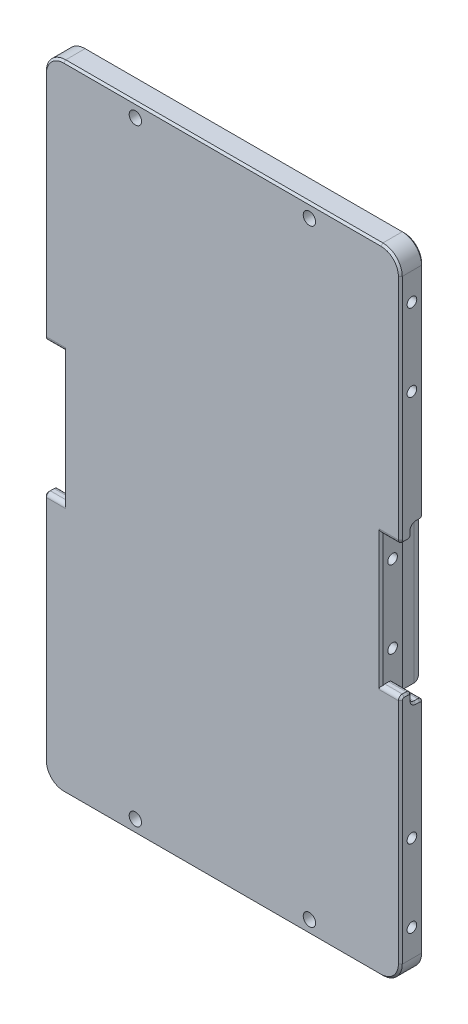
from build123d import *

# Parameters (mm, degrees)
SKETCH_1_W                  = 92
SKETCH_1_H                  = 164
EXTRUDE_1_DEPTH             = 3
SKETCH_97_W                 = 3
SKETCH_97_H                 = 34
CUT_EXTRUDE_1_DEPTH         = 5
HOLE_WIZARD_M3_1_AT_2_COUNT = 2
HOLE_WIZARD_M3_1_AT_2_PITCH = 20
HOLE_WIZARD_M3_2_AT_2_COUNT = 2
HOLE_WIZARD_M3_2_AT_2_PITCH = 140
HOLE_WIZARD_M3_2_AT_3_COUNT = 2
HOLE_WIZARD_M3_2_AT_3_PITCH = 20
HOLE_WIZARD_M3_2_AT_4_COUNT = 2
HOLE_WIZARD_M3_2_AT_4_PITCH = 120
FILLET_3_R                  = 5
FILLET_5_R                  = 1
CHAMFER_2_SIZE              = 0.5
SKETCH_119_R                = 1.6
CUT_EXTRUDE_6_DEPTH         = 95.212525707
CUT_EXTRUDE_7_DEPTH         = 3
CHAMFER_3_SIZE              = 3
SKETCH_122_W                = 81
SKETCH_122_H                = 42.1
EXTRUDE_3_DEPTH             = 6
FILLET_11_R                 = 3
SKETCH_123_W                = 63
SKETCH_123_H                = 24.1
CUT_EXTRUDE_8_DEPTH         = 6
FILLET_12_R                 = 3


with BuildPart() as part:
    # 草图1 → 凸台-拉伸1 (new, symmetric)
    with BuildSketch(Plane.XY):
        Rectangle(SKETCH_1_W, SKETCH_1_H)
    extrude(amount=EXTRUDE_1_DEPTH, both=True)

    # 草图97 → 切除-拉伸1 (cut)
    with BuildSketch(Plane.ZY.offset(46)):
        Polygon((-3, -20.05), (0, -20.05), (0, -17), (0, 17), (0, 20.05), (-3, 20.05), align=None)
        with Locations((1.5, 0)):
            Rectangle(SKETCH_97_W, SKETCH_97_H)
    cut_extrude_1 = extrude(amount=-CUT_EXTRUDE_1_DEPTH, mode=Mode.SUBTRACT)

    # 草图100 → M3 螺纹孔1 (revolve, cut)
    with BuildSketch(Plane(origin=(-41, 10, 0), x_dir=(0, 0, 1), z_dir=(0, 1, 0))):
        Polygon((0, 0), (0, 7.5), (1.25, 6.748924226), (1.25, 0), align=None)
    hole_wizard_m3_1 = revolve(axis=Axis((-47.35, 10, 0), (1, 0, 0)), mode=Mode.SUBTRACT)

    # M3 螺纹孔1 at 2: M3 螺纹孔1 ×2
    with Locations(*[(0, -i * HOLE_WIZARD_M3_1_AT_2_PITCH, 0) for i in range(1, HOLE_WIZARD_M3_1_AT_2_COUNT)]):
        add(hole_wizard_m3_1, mode=Mode.SUBTRACT)

    # 镜向1: 切除-拉伸1, M3 螺纹孔1 across plane
    add(cut_extrude_1.mirror(Plane(origin=(0, 0, 0), x_dir=(0, 0, 1), z_dir=(1, 0, 0))), mode=Mode.SUBTRACT)
    add(hole_wizard_m3_1.mirror(Plane(origin=(0, 0, 0), x_dir=(0, 0, 1), z_dir=(1, 0, 0))), mode=Mode.SUBTRACT)

    # 镜向1 copy 1 sketch → 镜向1 copy 1 (revolve, cut)
    with BuildSketch(Plane(origin=(41, -10, 0), x_dir=(0, 0, 1), z_dir=(0, 1, 0))):
        Polygon((0, 0), (0, -7.5), (1.25, -6.748924226), (1.25, 0), align=None)
    revolve(axis=Axis((47.35, -10, 0), (1, 0, 0)), mode=Mode.SUBTRACT)

    # 草图113 → M3 螺纹孔2 (revolve, cut)
    with BuildSketch(Plane(origin=(-46, -70, 0), x_dir=(0, 0, 1), z_dir=(0, 1, 0))):
        Polygon((0, 0), (0, 7.5), (1.25, 6.748924226), (1.25, 0), align=None)
    hole_wizard_m3_2 = revolve(axis=Axis((-52.35, -70, 0), (1, 0, 0)), mode=Mode.SUBTRACT)

    # M3 螺纹孔2 at 2: M3 螺纹孔2 ×2
    with Locations(*[(0, i * HOLE_WIZARD_M3_2_AT_2_PITCH, 0) for i in range(1, HOLE_WIZARD_M3_2_AT_2_COUNT)]):
        add(hole_wizard_m3_2, mode=Mode.SUBTRACT)

    # M3 螺纹孔2 at 3: M3 螺纹孔2 ×2
    with Locations(*[(0, i * HOLE_WIZARD_M3_2_AT_3_PITCH, 0) for i in range(1, HOLE_WIZARD_M3_2_AT_3_COUNT)]):
        add(hole_wizard_m3_2, mode=Mode.SUBTRACT)

    # M3 螺纹孔2 at 4: M3 螺纹孔2 ×2
    with Locations(*[(0, i * HOLE_WIZARD_M3_2_AT_4_PITCH, 0) for i in range(1, HOLE_WIZARD_M3_2_AT_4_COUNT)]):
        add(hole_wizard_m3_2, mode=Mode.SUBTRACT)

    # 镜向2: M3 螺纹孔2 across plane
    add(hole_wizard_m3_2.mirror(Plane(origin=(0, 0, 0), x_dir=(0, 0, 1), z_dir=(1, 0, 0))), mode=Mode.SUBTRACT)

    # 镜向2 copy 1 sketch → 镜向2 copy 1 (revolve, cut)
    with BuildSketch(Plane(origin=(46, 70, 0), x_dir=(0, 0, 1), z_dir=(0, 1, 0))):
        Polygon((0, 0), (0, -7.5), (1.25, -6.748924226), (1.25, 0), align=None)
    revolve(axis=Axis((52.35, 70, 0), (1, 0, 0)), mode=Mode.SUBTRACT)

    # 镜向2 copy 2 sketch → 镜向2 copy 2 (revolve, cut)
    with BuildSketch(Plane(origin=(46, -50, 0), x_dir=(0, 0, 1), z_dir=(0, 1, 0))):
        Polygon((0, 0), (0, -7.5), (1.25, -6.748924226), (1.25, 0), align=None)
    revolve(axis=Axis((52.35, -50, 0), (1, 0, 0)), mode=Mode.SUBTRACT)

    # 镜向2 copy 3 sketch → 镜向2 copy 3 (revolve, cut)
    with BuildSketch(Plane(origin=(46, 50, 0), x_dir=(0, 0, 1), z_dir=(0, 1, 0))):
        Polygon((0, 0), (0, -7.5), (1.25, -6.748924226), (1.25, 0), align=None)
    revolve(axis=Axis((52.35, 50, 0), (1, 0, 0)), mode=Mode.SUBTRACT)

    # 圆角3
    fillet_3_edges = [part.edges().sort_by_distance(p)[0] for p in [
        (46, -82, 0),
        (-46, -82, 0),
        (-46, 82, 0),
        (46, 82, 0),
    ]]
    fillet(fillet_3_edges, radius=FILLET_3_R)

    # 圆角5
    fillet_5_edges = [part.edges().sort_by_distance(p)[0] for p in [
        (-43.5, -17, 0),
        (-43.5, -20.05, 0),
        (-43.5, -20.05, -3),
        (-43.5, 20.05, -3),
        (-43.5, 20.05, 0),
        (-43.5, 17, 0),
        (-43.5, 17, 3),
        (-43.5, -17, 3),
        (43.5, -20.05, 0),
        (43.5, -17, 0),
        (43.5, -17, 3),
        (43.5, 17, 3),
        (43.5, 17, 0),
        (43.5, 20.05, 0),
        (43.5, 20.05, -3),
        (43.5, -20.05, -3),
    ]]
    fillet(fillet_5_edges, radius=FILLET_5_R)

    # 倒角2
    chamfer_2_edges = [part.edges().sort_by_distance(p)[0] for p in [
        (-46, 49.025, -3),
        (-46, 47.5, 3),
        (46, -49.025, -3),
        (0, -82, -3),
        (0, 82, -3),
        (-44.535533906, -80.535533906, -3),
        (44.535533906, -80.535533906, -3),
        (44.535533906, 80.535533906, -3),
        (-44.535533906, 80.535533906, -3),
        (0, 82, 3),
        (46, -47.5, 3),
        (0, -82, 3),
        (-44.535533906, -80.535533906, 3),
        (44.535533906, -80.535533906, 3),
        (44.535533906, 80.535533906, 3),
        (-44.535533906, 80.535533906, 3),
        (-46, -20.05, -1.5),
        (-46, -49.025, -3),
        (-46, -47.5, 3),
        (-46, -17, 1.5),
        (-46, -18.525, 0),
        (-46, -17.292893219, 0.292893219),
        (-46, -17.292893219, 2.707106781),
        (-46, -20.342893219, -2.707106781),
        (46, 49.025, -3),
        (-46, 20.05, -1.5),
        (-46, 18.525, 0),
        (-46, 17, 1.5),
        (-46, 17.292893219, 0.292893219),
        (-46, 17.292893219, 2.707106781),
        (-46, 20.342893219, -2.707106781),
        (46, -20.05, -1.5),
        (46, -18.525, 0),
        (46, -17, 1.5),
        (46, -17.292893219, 0.292893219),
        (46, -17.292893219, 2.707106781),
        (46, -20.342893219, -2.707106781),
        (46, 20.05, -1.5),
        (46, 47.5, 3),
        (46, 17, 1.5),
        (46, 18.525, 0),
        (46, 17.292893219, 0.292893219),
        (46, 17.292893219, 2.707106781),
        (46, 20.342893219, -2.707106781),
        (46, -19.757106781, -0.292893219),
        (46, 19.757106781, -0.292893219),
        (-46, 19.757106781, -0.292893219),
        (-46, -19.757106781, -0.292893219),
        (-41, 0, -3),
        (-41, 0, 3),
        (41, 0, 3),
        (41, 0, -3),
    ]]
    chamfer(chamfer_2_edges, length=CHAMFER_2_SIZE)

    # 草图119 → 切除-拉伸6 (cut, through all)
    with BuildSketch(Plane(origin=(0, 0, -3), x_dir=(-1, 0, 0), z_dir=(0, 0, -1))):
        with Locations((22.5, 78.5)):
            Circle(SKETCH_119_R)
        with Locations(Location((-22.5, 78.5, 0), (0, 0, 180))):
            Circle(SKETCH_119_R)
        with Locations(Location((22.5, -78.5, 0), (0, 0, 180))):
            Circle(SKETCH_119_R)
        with Locations((-22.5, -78.5)):
            Circle(SKETCH_119_R)
    extrude(amount=-CUT_EXTRUDE_6_DEPTH, mode=Mode.SUBTRACT)

    # 草图120 → 切除-拉伸7 (cut)
    with BuildSketch(Plane(origin=(0, 0, -3), x_dir=(-1, 0, 0), z_dir=(0, 0, -1))):
        with BuildLine():
            Line((-26.5, 21.05), (26.5, 21.05))
            ThreePointArc((26.5, 21.05), (29.328427125, 22.221572875), (30.5, 25.05))
            Line((30.5, 25.05), (30.5, 31.05))
            Line((30.5, 31.05), (31.5, 31.05))
            ThreePointArc((31.5, 31.05), (34.328427125, 32.221572875), (35.5, 35.05))
            Line((35.5, 35.05), (35.5, 67.5))
            ThreePointArc((35.5, 67.5), (34.328427125, 70.328427125), (31.5, 71.5))
            Line((31.5, 71.5), (-31.5, 71.5))
            ThreePointArc((-31.5, 71.5), (-34.328427125, 70.328427125), (-35.5, 67.5))
            Line((-35.5, 67.5), (-35.5, 35.05))
            ThreePointArc((-35.5, 35.05), (-34.328427125, 32.221572875), (-31.5, 31.05))
            Line((-31.5, 31.05), (-30.5, 31.05))
            Line((-30.5, 31.05), (-30.5, 25.05))
            ThreePointArc((-30.5, 25.05), (-29.328427125, 22.221572875), (-26.5, 21.05))
        make_face()
        with BuildLine():
            Line((30.5, -31.05), (30.5, -25.05))
            ThreePointArc((30.5, -25.05), (29.328427125, -22.221572875), (26.5, -21.05))
            Line((26.5, -21.05), (-26.5, -21.05))
            ThreePointArc((-26.5, -21.05), (-29.328427125, -22.221572875), (-30.5, -25.05))
            Line((-30.5, -25.05), (-30.5, -31.05))
            Line((-30.5, -31.05), (-31.5, -31.05))
            ThreePointArc((-31.5, -31.05), (-34.328427125, -32.221572875), (-35.5, -35.05))
            Line((-35.5, -35.05), (-35.5, -67.5))
            ThreePointArc((-35.5, -67.5), (-34.328427125, -70.328427125), (-31.5, -71.5))
            Line((-31.5, -71.5), (31.5, -71.5))
            ThreePointArc((31.5, -71.5), (34.328427125, -70.328427125), (35.5, -67.5))
            Line((35.5, -67.5), (35.5, -35.05))
            ThreePointArc((35.5, -35.05), (34.328427125, -32.221572875), (31.5, -31.05))
            Line((31.5, -31.05), (30.5, -31.05))
        make_face()
    extrude(amount=-CUT_EXTRUDE_7_DEPTH, mode=Mode.SUBTRACT)

    # 倒角3
    chamfer_3_edges = [part.edges().sort_by_distance(p)[0] for p in [
        (34.328427125, 32.221572875, 0),
        (35.5, 51.275, 0),
        (34.328427125, 70.328427125, 0),
        (0, 71.5, 0),
        (-34.328427125, 70.328427125, 0),
        (-35.5, 51.275, 0),
        (-34.328427125, 32.221572875, 0),
        (-31, 31.05, 0),
        (-30.5, 28.05, 0),
        (-29.328427125, 22.221572875, 0),
        (0, 21.05, 0),
        (29.328427125, 22.221572875, 0),
        (30.5, 28.05, 0),
        (31, 31.05, 0),
        (0, -71.5, 0),
        (34.328427125, -70.328427125, 0),
        (35.5, -51.275, 0),
        (34.328427125, -32.221572875, 0),
        (31, -31.05, 0),
        (30.5, -28.05, 0),
        (29.328427125, -22.221572875, 0),
        (0, -21.05, 0),
        (-29.328427125, -22.221572875, 0),
        (-30.5, -28.05, 0),
        (-31, -31.05, 0),
        (-34.328427125, -32.221572875, 0),
        (-35.5, -51.275, 0),
        (-34.328427125, -70.328427125, 0),
    ]]
    chamfer(chamfer_3_edges, length=CHAMFER_3_SIZE - 0.0001)  # a hair under: the kernel refuses the full size

    # 草图122 → 凸台-拉伸3 (add)
    with BuildSketch(Plane(origin=(0, 0, -3), x_dir=(-1, 0, 0), z_dir=(0, 0, -1))):
        Rectangle(SKETCH_122_W, SKETCH_122_H)
    extrude(amount=EXTRUDE_3_DEPTH)

    # 圆角11
    fillet_11_edges = [part.edges().sort_by_distance(p)[0] for p in [
        (40.5, 0, -9),
        (0, -21.05, -9),
        (-40.5, 0, -9),
        (0, 21.05, -9),
    ]]
    fillet(fillet_11_edges, radius=FILLET_11_R)

    # 草图123 → 切除-拉伸8 (cut)
    with BuildSketch(Plane(origin=(0, 0, -9), x_dir=(-1, 0, 0), z_dir=(0, 0, -1))):
        Rectangle(SKETCH_123_W, SKETCH_123_H)
    extrude(amount=-CUT_EXTRUDE_8_DEPTH, mode=Mode.SUBTRACT)

    # 圆角12
    fillet_12_edges = [part.edges().sort_by_distance(p)[0] for p in [
        (-31.5, -12.05, -6),
        (31.5, -12.05, -6),
        (31.5, 12.05, -6),
        (-31.5, 12.05, -6),
    ]]
    fillet(fillet_12_edges, radius=FILLET_12_R)


solid = part.part
